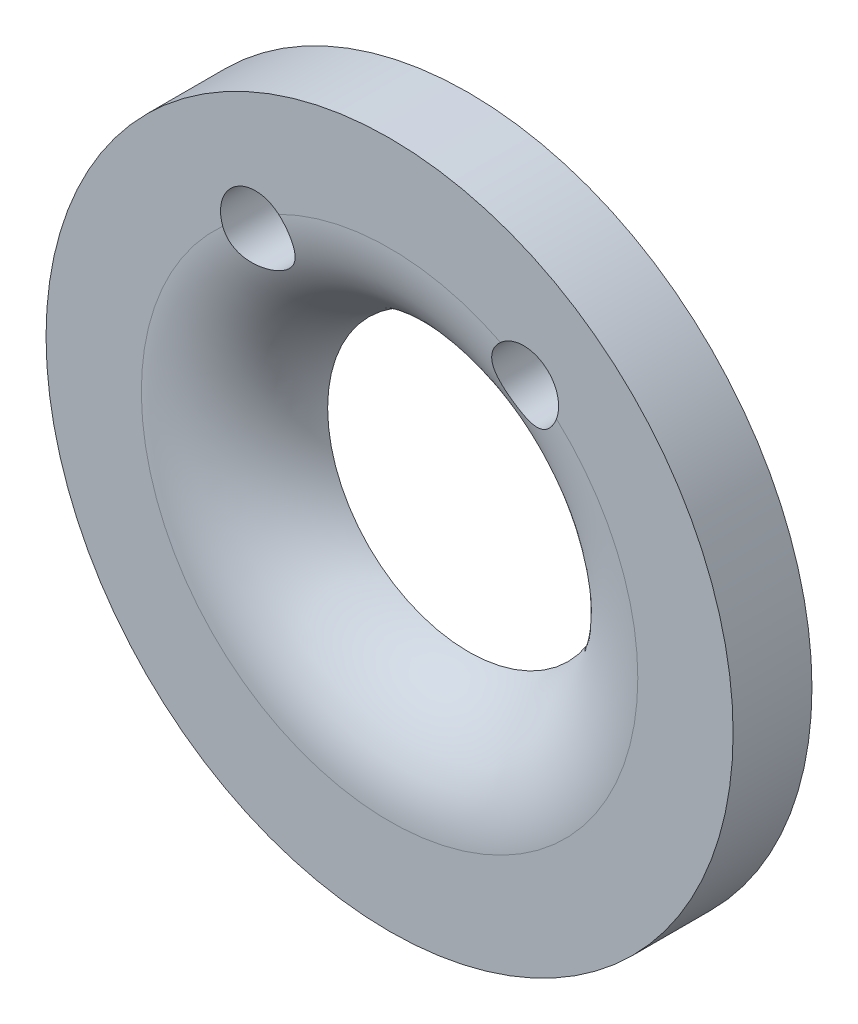
from build123d import *

# Parameters (mm, degrees)
SKETCH1_R                        = 30.5
BOSS_EXTRUDE1_DEPTH              = 7
SKETCH2_R                        = 3.1
F_2X_6_2_MM_AND_25_MM_THRU_DEPTH = 44.697826033
F_10MM_FILET_R                   = 10


with BuildPart() as part:
    # Sketch1 → Boss-Extrude1 (new body)
    with BuildSketch(Plane(origin=(0, 0, 0), x_dir=(0, 1, 0), z_dir=(0, 0, 1))):
        with Locations(Location((0, 0, 0), (0, 0, 270))):
            Circle(SKETCH1_R)
    extrude(amount=BOSS_EXTRUDE1_DEPTH)

    # Sketch2 → 2x 6.2 mm and 25 mm thru (cut, through all)
    with BuildSketch(Plane.XY.offset(7)):
        with BuildLine():
            ThreePointArc((12.5, 0), (8.838834765, 8.838834765), (0, 12.5))
            Line((0, 12.5), (0, -12.5))
            ThreePointArc((0, -12.5), (8.838834765, -8.838834765), (12.5, 0))
        make_face()
        with BuildLine():
            Line((0, -12.5), (0, 12.5))
            ThreePointArc((0, 12.5), (-12.5, 0), (0, -12.5))
        make_face()
        with Locations((-11.907432919, 17.394401462)):
            Circle(SKETCH2_R)
        with Locations((11.907432919, 17.394401462)):
            Circle(SKETCH2_R)
    extrude(amount=-F_2X_6_2_MM_AND_25_MM_THRU_DEPTH, mode=Mode.SUBTRACT)

    # 10mm filet
    # the kernel refuses this fillet: 10 mm, written as the material it takes off along each edge
    with BuildSketch(Plane(origin=(0, 0, 7), x_dir=(0, -1, 0), z_dir=(1, 0, 0))) as f_10mm_filet_piece_1:
        with BuildLine():
            CenterArc((22.039392014, 10), F_10MM_FILET_R, 197.457603124, 72.542396876)
            Line((12.5, 7), (12.30921216, 6.94))
            ThreePointArc((12.30921216, 6.94), (12.3, 3.5), (12.3, 0))
            Line((12.3, 0), (12.5, -0.2))
            Line((12.5, -0.2), (22.039392014, -0.2))
            Line((22.039392014, -0.2), (22.039392014, 0))
        make_face()
    revolve(axis=Axis((0, 0, 7), (0, 0, -1)), mode=Mode.SUBTRACT)


solid = part.part
